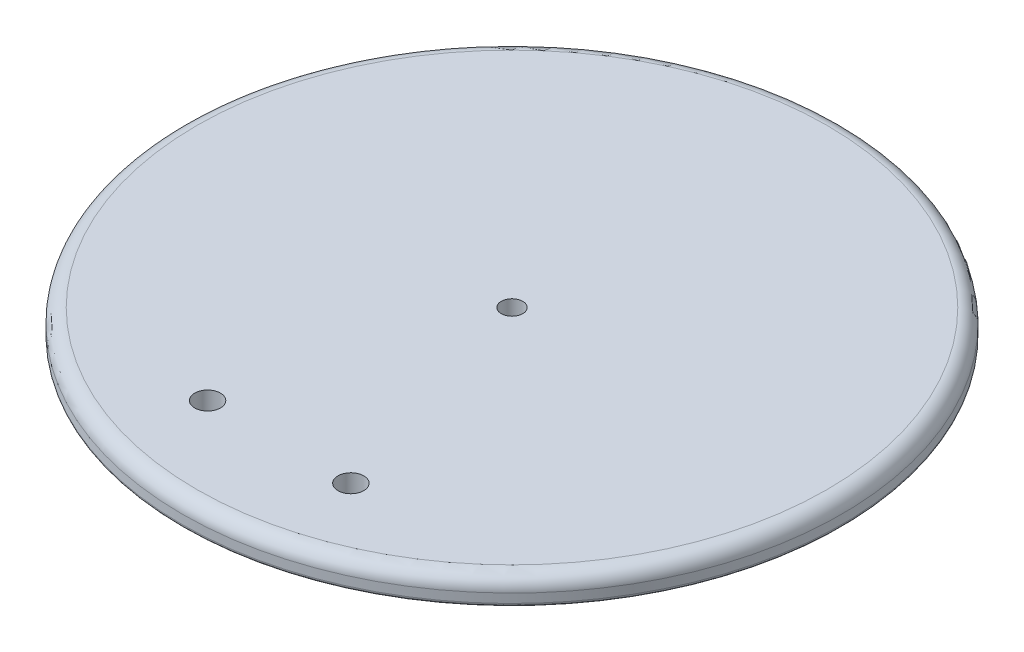
from build123d import *

# Parameters (mm, degrees)
COMBINE1_START         = 3.413749169
COMBINE1_OUTLINE_R     = 58.42
COMBINE1_OUTLINE_R_2   = 4.935
COMBINE1_OUTLINE_R_3   = 3.57
COMBINE1_OUTLINE_R_4   = 0.7875
COMBINE1_OUTLINE_R_5   = 3.15
COMBINE1_DEPTH         = 9.525
COMBINE1_START_2       = 4.053454325
COMBINE1_2_OUTLINE_R   = 0.7875
COMBINE1_2_OUTLINE_R_2 = 4.935
COMBINE1_2_OUTLINE_R_3 = 3.57
COMBINE1_2_OUTLINE_R_4 = 3.15
COMBINE1_2_DEPTH       = 8.885294844
CUT_EXTRUDE1_DEPTH     = 0.762
CUT_EXTRUDE2_START     = -4.7625
SKETCH4_R              = 58.42
CUT_EXTRUDE2_DEPTH     = 4.7625
CUT_EXTRUDE3_REACH     = 153.512
SKETCH7_R              = 1.905
FILLET2_R              = 2.54
FILLET5_R              = 0.635
SKETCH9_R              = 1.999996
CUT_EXTRUDE5_DEPTH     = 152.549922909
CUT_EXTRUDE6_REACH     = 153.55
SKETCH10_R             = 2.286
CUT_EXTRUDE9_REACH     = 153.512


with BuildPart() as part:
    # Combine1: read off the stored shape, not the designer's step
    # Combine1 outline → Combine1 (new body)
    # profile 1 of 11: a face of its own
    with BuildSketch(Plane(origin=(0, 0, 0), x_dir=(1, 0, 0), z_dir=(0, 1, 0)).offset(COMBINE1_START)):
        with Locations((59.332644984, 36.863851119)):
            Circle(COMBINE1_OUTLINE_R)
        with BuildLine():
            Line((55.998151143, 41.896996961), (61.361898263, 54.627286485))
            ThreePointArc((61.361898263, 54.627286485), (64.45492948, 56.145051848), (66.38688961, 53.292336674))
            Line((66.38688961, 53.292336674), (64.725431473, 39.578489242))
            ThreePointArc((64.725431473, 39.578489242), (65.167745205, 35.313686074), (62.667138826, 31.830705276))
            Line((62.667138826, 31.830705276), (57.303391705, 19.100415753))
            ThreePointArc((57.303391705, 19.100415753), (54.210360488, 17.58265039), (52.278400358, 20.435365564))
            Line((52.278400358, 20.435365564), (53.939858496, 34.149212996))
            ThreePointArc((53.939858496, 34.149212996), (53.32735594, 36.24102711), (53.497544764, 38.414016164))
            ThreePointArc((53.497544764, 38.414016164), (54.428243632, 40.384966514), (55.998151143, 41.896996961))
        make_face(mode=Mode.SUBTRACT)
    # profile 2 of 11: a face of its own
    with BuildSketch(Plane(origin=(0, 0, 0), x_dir=(1, 0, 0), z_dir=(0, 1, 0)).offset(COMBINE1_START)):
        with Locations((59.332644984, 36.863851119)):
            Circle(COMBINE1_OUTLINE_R_2)
        with Locations((59.332644984, 36.863851118)):
            Circle(COMBINE1_OUTLINE_R_3, mode=Mode.SUBTRACT)
    # profile 3 of 11: a face of its own
    with BuildSketch(Plane(origin=(0, 0, 0), x_dir=(1, 0, 0), z_dir=(0, 1, 0)).offset(COMBINE1_START)):
        with BuildLine():
            ThreePointArc((61.980902459, 43.765255947), (61.42199787, 44.728551416), (60.458702401, 44.169646828))
            ThreePointArc((60.458702401, 44.169646828), (61.01760699, 43.206351359), (61.980902459, 43.765255947))
        make_face()
    # profile 4 of 11: a face of its own
    with BuildSketch(Plane(origin=(0, 0, 0), x_dir=(1, 0, 0), z_dir=(0, 1, 0)).offset(COMBINE1_START)):
        with BuildLine():
            ThreePointArc((62.789684222, 46.809656062), (62.230779633, 47.772951531), (61.267484164, 47.214046943))
            ThreePointArc((61.267484164, 47.214046943), (61.826388753, 46.250751474), (62.789684222, 46.809656062))
        make_face()
    # profile 5 of 11: a face of its own
    with BuildSketch(Plane(origin=(0, 0, 0), x_dir=(1, 0, 0), z_dir=(0, 1, 0)).offset(COMBINE1_START)):
        with Locations((62.837365955, 50.056251617)):
            Circle(COMBINE1_OUTLINE_R_4)
    # profile 6 of 11: a face of its own
    with BuildSketch(Plane(origin=(0, 0, 0), x_dir=(1, 0, 0), z_dir=(0, 1, 0)).offset(COMBINE1_START)):
        with BuildLine():
            ThreePointArc((64.407247747, 52.898456292), (63.848343158, 53.861751761), (62.885047689, 53.302847173))
            ThreePointArc((62.885047689, 53.302847173), (63.443952278, 52.339551704), (64.407247747, 52.898456292))
        make_face()
    # profile 7 of 11: a face of its own
    with BuildSketch(Plane(origin=(0, 0, 0), x_dir=(1, 0, 0), z_dir=(0, 1, 0)).offset(COMBINE1_START)):
        with Locations((57.445487539, 29.76025085)):
            Circle(COMBINE1_OUTLINE_R_4)
    # profile 8 of 11: a face of its own
    with BuildSketch(Plane(origin=(0, 0, 0), x_dir=(1, 0, 0), z_dir=(0, 1, 0)).offset(COMBINE1_START)):
        with Locations((56.636705775, 26.715850735)):
            Circle(COMBINE1_OUTLINE_R_4)
    # profile 9 of 11: a face of its own
    with BuildSketch(Plane(origin=(0, 0, 0), x_dir=(1, 0, 0), z_dir=(0, 1, 0)).offset(COMBINE1_START)):
        with BuildLine():
            ThreePointArc((56.589024042, 23.46925518), (56.030119453, 24.432550649), (55.066823984, 23.873646061))
            ThreePointArc((55.066823984, 23.873646061), (55.625728573, 22.910350592), (56.589024042, 23.46925518))
        make_face()
    # profile 10 of 11: a face of its own
    with BuildSketch(Plane(origin=(0, 0, 0), x_dir=(1, 0, 0), z_dir=(0, 1, 0)).offset(COMBINE1_START)):
        with BuildLine():
            ThreePointArc((55.780242279, 20.424855065), (55.221337691, 21.388150534), (54.258042222, 20.829245946))
            ThreePointArc((54.258042222, 20.829245946), (54.81694681, 19.865950476), (55.780242279, 20.424855065))
        make_face()
    # profile 11 of 11: a face of its own
    with BuildSketch(Plane(origin=(0, 0, 0), x_dir=(1, 0, 0), z_dir=(0, 1, 0)).offset(COMBINE1_START)):
        with Locations((59.332644984, 36.863851119)):
            Circle(COMBINE1_OUTLINE_R_5)
    extrude(amount=COMBINE1_DEPTH)

    # Combine1 2 outline → Combine1 2 (add)
    # profile 1 of 2: a face of its own
    with BuildSketch(Plane(origin=(0, 0, 0), x_dir=(1, 0, 0), z_dir=(0, 1, 0)).offset(COMBINE1_START_2)):
        with BuildLine():
            ThreePointArc((66.38688961, 53.292336674), (64.45492948, 56.145051848), (61.361898263, 54.627286485))
            Line((61.361898263, 54.627286485), (55.998151143, 41.896996961))
            ThreePointArc((55.998151143, 41.896996961), (54.428243632, 40.384966514), (53.497544764, 38.414016164))
            ThreePointArc((53.497544764, 38.414016164), (53.32735594, 36.24102711), (53.939858496, 34.149212996))
            Line((53.939858496, 34.149212996), (52.278400358, 20.435365564))
            ThreePointArc((52.278400358, 20.435365564), (54.210360488, 17.58265039), (57.303391705, 19.100415753))
            Line((57.303391705, 19.100415753), (62.667138826, 31.830705276))
            ThreePointArc((62.667138826, 31.830705276), (65.167745205, 35.313686074), (64.725431473, 39.578489242))
            Line((64.725431473, 39.578489242), (66.38688961, 53.292336674))
        make_face()
        with BuildLine():
            ThreePointArc((55.780242279, 20.424855065), (54.81694681, 19.865950476), (54.258042222, 20.829245946))
            ThreePointArc((54.258042222, 20.829245946), (55.221337691, 21.388150534), (55.780242279, 20.424855065))
        make_face(mode=Mode.SUBTRACT)
        with BuildLine():
            ThreePointArc((56.589024042, 23.46925518), (55.625728573, 22.910350592), (55.066823984, 23.873646061))
            ThreePointArc((55.066823984, 23.873646061), (56.030119453, 24.432550649), (56.589024042, 23.46925518))
        make_face(mode=Mode.SUBTRACT)
        with Locations((56.636705775, 26.715850735)):
            Circle(COMBINE1_2_OUTLINE_R, mode=Mode.SUBTRACT)
        with Locations((57.445487539, 29.760250851)):
            Circle(COMBINE1_2_OUTLINE_R, mode=Mode.SUBTRACT)
        with Locations((59.332644984, 36.863851119)):
            Circle(COMBINE1_2_OUTLINE_R_2, mode=Mode.SUBTRACT)
        with BuildLine():
            ThreePointArc((61.980902459, 43.765255947), (61.01760699, 43.206351359), (60.458702401, 44.169646828))
            ThreePointArc((60.458702401, 44.169646828), (61.42199787, 44.728551416), (61.980902459, 43.765255947))
        make_face(mode=Mode.SUBTRACT)
        with BuildLine():
            ThreePointArc((62.789684222, 46.809656062), (61.826388753, 46.250751474), (61.267484164, 47.214046943))
            ThreePointArc((61.267484164, 47.214046943), (62.230779633, 47.772951531), (62.789684222, 46.809656062))
        make_face(mode=Mode.SUBTRACT)
        with Locations((62.837365955, 50.056251617)):
            Circle(COMBINE1_2_OUTLINE_R, mode=Mode.SUBTRACT)
        with BuildLine():
            ThreePointArc((64.407247747, 52.898456292), (63.443952278, 52.339551704), (62.885047689, 53.302847173))
            ThreePointArc((62.885047689, 53.302847173), (63.848343158, 53.861751761), (64.407247747, 52.898456292))
        make_face(mode=Mode.SUBTRACT)
    # profile 2 of 2: a face of its own
    with BuildSketch(Plane(origin=(0, 0, 0), x_dir=(1, 0, 0), z_dir=(0, 1, 0)).offset(COMBINE1_START_2)):
        with Locations((59.332644984, 36.863851118)):
            Circle(COMBINE1_2_OUTLINE_R_3)
        with Locations((59.332644984, 36.863851119)):
            Circle(COMBINE1_2_OUTLINE_R_4, mode=Mode.SUBTRACT)
    extrude(amount=COMBINE1_2_DEPTH)

    # Sketch1 → Cut-Extrude1 (cut, symmetric)
    with BuildSketch(Plane.XZ.offset(-4.053454325)):
        with BuildLine():
            Line((52.278400358, -20.435365564), (53.939858496, -34.149212996))
            ThreePointArc((53.939858496, -34.149212996), (53.497544764, -38.414016164), (55.998151143, -41.896996961))
            Line((55.998151143, -41.896996961), (61.361898263, -54.627286485))
            ThreePointArc((61.361898263, -54.627286485), (64.45492948, -56.145051848), (66.38688961, -53.292336674))
            Line((66.38688961, -53.292336674), (64.725431473, -39.578489242))
            ThreePointArc((64.725431473, -39.578489242), (65.167745205, -35.313686074), (62.667138826, -31.830705276))
            Line((62.667138826, -31.830705276), (57.303391705, -19.100415753))
            ThreePointArc((57.303391705, -19.100415753), (54.210360488, -17.58265039), (52.278400358, -20.435365564))
        make_face()
    extrude(amount=CUT_EXTRUDE1_DEPTH, both=True, mode=Mode.SUBTRACT)

    # Sketch4 → Cut-Extrude2 (cut)
    with BuildSketch(Plane(origin=(0, 12.938749169, 0), x_dir=(1, 0, 0), z_dir=(0, 1, 0)).offset(CUT_EXTRUDE2_START)):
        with Locations(Location((59.332644984, 36.863851119, 0), (0, 0, 90))):
            Circle(SKETCH4_R)
    extrude(amount=CUT_EXTRUDE2_DEPTH, mode=Mode.SUBTRACT)

    # Sketch7 → Cut-Extrude3 (cut, up to next)
    with BuildSketch(Plane.XZ.offset(-4.815454325), mode=Mode.PRIVATE) as cut_extrude3_sk1:
        with Locations(Location((59.332644984, -36.863851119, 0), (0, 0, 270))):
            Circle(SKETCH7_R)
    cut_extrude3_tool1 = extrude(cut_extrude3_sk1.sketch, amount=-CUT_EXTRUDE3_REACH, mode=Mode.PRIVATE) & part.part
    add(cut_extrude3_tool1.solids().sort_by_distance((59.332645, 4.815454, -36.863851))[0], mode=Mode.SUBTRACT)

    # Fillet2
    fillet2_edges = [part.edges().sort_by_distance(p)[0] for p in [
        (0.912644984, 8.176249169, -36.863851119),
    ]]
    fillet(fillet2_edges, radius=FILLET2_R)

    # Fillet5
    fillet5_edges = [part.edges().sort_by_distance(p)[0] for p in [
        (0.912644984, 3.413749169, -36.863851119),
    ]]
    fillet(fillet5_edges, radius=FILLET5_R)

    # Sketch9 → Cut-Extrude5 (cut, through all)
    with BuildSketch(Plane(origin=(0, 8.176249169, 0), x_dir=(1, 0, 0), z_dir=(0, 1, 0))):
        with Locations(Location((46.632644984, -4.398077679, 0), (0, 0, 270))):
            Circle(SKETCH9_R)
        with Locations(Location((72.032644984, -4.398077679, 0), (0, 0, 90))):
            Circle(SKETCH9_R)
    extrude(amount=-CUT_EXTRUDE5_DEPTH, mode=Mode.SUBTRACT)

    # Sketch10 → Cut-Extrude6 (cut, up to next)
    with BuildSketch(Plane(origin=(0, 8.176249169, 0), x_dir=(1, 0, 0), z_dir=(0, 1, 0)), mode=Mode.PRIVATE) as cut_extrude6_sk1:
        with Locations(Location((46.632644984, -4.398077679, 0), (0, 0, 270))):
            Circle(SKETCH10_R)
    cut_extrude6_tool1 = extrude(cut_extrude6_sk1.sketch, amount=-CUT_EXTRUDE6_REACH, mode=Mode.PRIVATE) & part.part
    # Sketch10 → Cut-Extrude6 (cut, up to next)
    with BuildSketch(Plane(origin=(0, 8.176249169, 0), x_dir=(1, 0, 0), z_dir=(0, 1, 0)), mode=Mode.PRIVATE) as cut_extrude6_sk2:
        with Locations(Location((72.032644984, -4.398077679, 0), (0, 0, 270))):
            Circle(SKETCH10_R)
    cut_extrude6_tool2 = extrude(cut_extrude6_sk2.sketch, amount=-CUT_EXTRUDE6_REACH, mode=Mode.PRIVATE) & part.part
    add(cut_extrude6_tool1.solids().sort_by_distance((46.632645, 8.176249, 4.398078))[0], mode=Mode.SUBTRACT)
    add(cut_extrude6_tool2.solids().sort_by_distance((72.032645, 8.176249, 4.398078))[0], mode=Mode.SUBTRACT)

    # Sketch11 → Cut-Extrude9 (cut, up to next)
    with BuildSketch(Plane.XZ.offset(-4.815454325), mode=Mode.PRIVATE) as cut_extrude9_sk1:
        with BuildLine():
            Line((60.823082896, -55.166101852), (55.459335776, -42.435812329))
            ThreePointArc((55.459335776, -42.435812329), (53.747699314, -40.778387244), (52.761089879, -38.609664323))
            ThreePointArc((52.761089879, -38.609664323), (52.541285954, -36.237230232), (53.204671891, -33.948851682))
            Line((53.204671891, -33.948851682), (51.543213753, -20.235004251))
            ThreePointArc((51.543213753, -20.235004251), (52.189851491, -18.110953809), (54.014712328, -16.846195505))
            ThreePointArc((54.014712328, -16.846195505), (56.22666621, -17.038525088), (57.842207073, -18.561600386))
            Line((57.842207073, -18.561600386), (63.205954193, -31.291889909))
            ThreePointArc((63.205954193, -31.291889909), (64.917590654, -32.949314993), (65.90420009, -35.118037914))
            ThreePointArc((65.90420009, -35.118037914), (66.124004014, -37.490472006), (65.460618078, -39.778850555))
            Line((65.460618078, -39.778850555), (67.122076215, -53.492697987))
            ThreePointArc((67.122076215, -53.492697987), (66.475438477, -55.616748428), (64.65057764, -56.881506733))
            ThreePointArc((64.65057764, -56.881506733), (62.438623759, -56.68917715), (60.823082896, -55.166101852))
        make_face()
    cut_extrude9_tool1 = extrude(cut_extrude9_sk1.sketch, amount=CUT_EXTRUDE9_REACH, mode=Mode.PRIVATE) & part.part
    add(cut_extrude9_tool1.solids().sort_by_distance((59.332645, 4.815454, -36.863851))[0], mode=Mode.SUBTRACT)


solid = part.part
